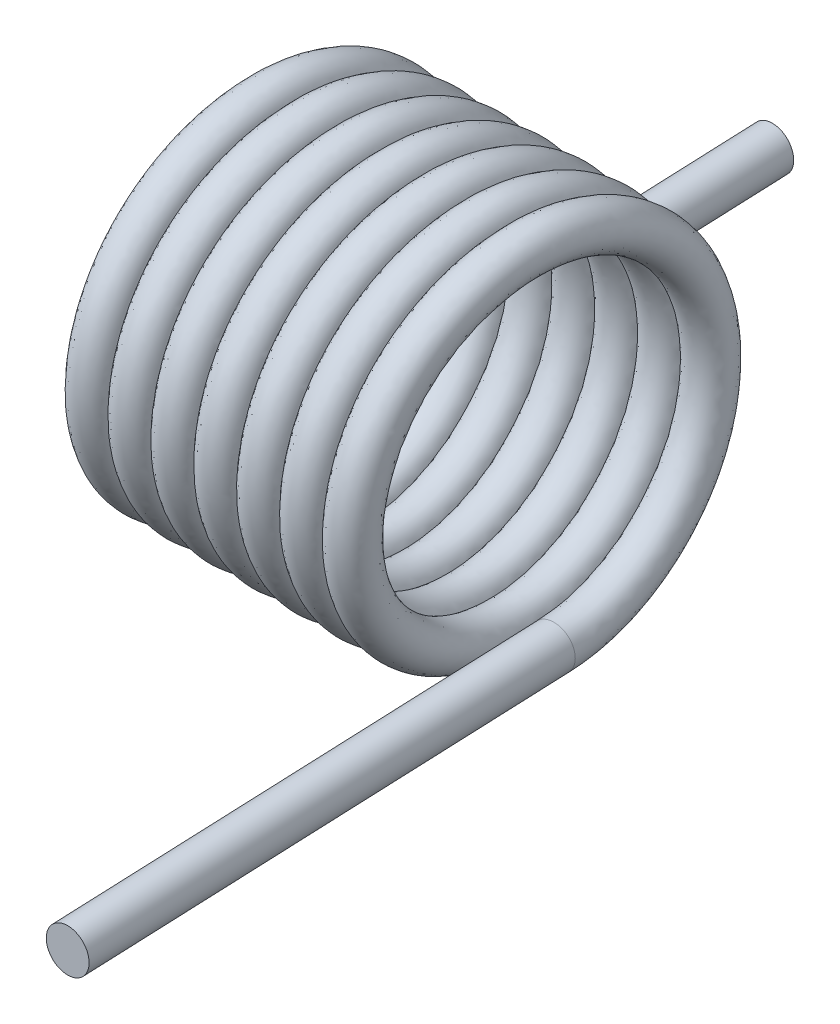
from build123d import *

# Parameters (mm, degrees)
SWEEP1_PITCH            = 0.5344
SWEEP1_HEIGHT           = 3.7408
SWEEP1_RADIUS           = 2.0955
SWEEP1_START_ANGLE      = 90
SKETCH2_R               = 0.2667
SKETCH3_R               = 0.2667
EXTRUDE1_DEPTH          = 19.05
SKETCH4_R               = 0.2667
EXTRUDE2_DEPTH          = 19.05
SKETCH6_W               = 13.151416604
SKETCH6_H               = 0.5334
CUT_EXTRUDE1_DEPTH      = 2.54
CUT_EXTRUDE4_DEPTH      = 20.777372659
CUT_EXTRUDE4_DEPTH_BACK = 20.777372659
SKETCH7_W               = 13.316571384
SKETCH7_H               = 0.5334


with BuildPart() as part:
    # Sweep1: sweep along a helix
    with BuildLine() as sweep1_path:
        add(Helix(SWEEP1_PITCH, SWEEP1_HEIGHT, SWEEP1_RADIUS, center=(0, 0, 0), direction=(1, 0, 0), lefthand=True, mode=Mode.PRIVATE).rotate(Axis((0, 0, 0), (1, 0, 0)), SWEEP1_START_ANGLE))
    # Sketch2 → Sweep1 (sweep)
    with BuildSketch(Plane(origin=(0, -2.0955, 0), x_dir=(0.9991773186540551, 2.6783880820766876e-14, -0.0405547270647073), z_dir=(0.0405547270647073, -1.1129460556273656e-14, 0.9991773186540551))):
        Circle(SKETCH2_R)
    sweep(path=sweep1_path.line, is_frenet=True)

    # Sketch3 → Extrude1 (add)
    with BuildSketch(Plane(origin=(0, 0, 0), x_dir=(-0.9991773186540551, -2.6756127908225113e-14, 0.04055472706470731), z_dir=(-0.04055472706470731, 1.112946055627366e-14, -0.9991773186540551))):
        with Locations(Location((0, -2.0955, 0), (0, 0, 180))):
            Circle(SKETCH3_R)
    extrude(amount=EXTRUDE1_DEPTH)

    # Sketch4 → Extrude2 (add)
    with BuildSketch(Plane(origin=(0.006152441, 0, 0.151582316), x_dir=(0.995509646352292, -0.08560321397472152, -0.040405863147971725), z_dir=(0.0405547270647073, 8.655272679125581e-14, 0.9991773186540551))):
        with Locations(Location((3.90338402, -1.767847005, 0), (0, 0, 4.910712917))):
            Circle(SKETCH4_R)
    extrude(amount=EXTRUDE2_DEPTH)

    # Sketch6 → Cut-Extrude1 (cut)
    with BuildSketch(Plane(origin=(0, 0, 0), x_dir=(0, 0, -1), z_dir=(1, 0, 0))):
        with Locations((13.323577913, -2.0955)):
            Rectangle(SKETCH6_W, SKETCH6_H)
    extrude(amount=-CUT_EXTRUDE1_DEPTH, mode=Mode.SUBTRACT)

    # Sketch7 → Cut-Extrude4 (cut, two sides: drawn at the far end of the back side and taken through both)
    with BuildSketch(Plane(origin=(0, 0, 0), x_dir=(0, 0, -1), z_dir=(1, 0, 0)).offset(-CUT_EXTRUDE4_DEPTH_BACK)):
        with Locations((-12.963103937, -2.0955)):
            Rectangle(SKETCH7_W, SKETCH7_H)
    extrude(amount=CUT_EXTRUDE4_DEPTH + CUT_EXTRUDE4_DEPTH_BACK, mode=Mode.SUBTRACT)


solid = part.part
